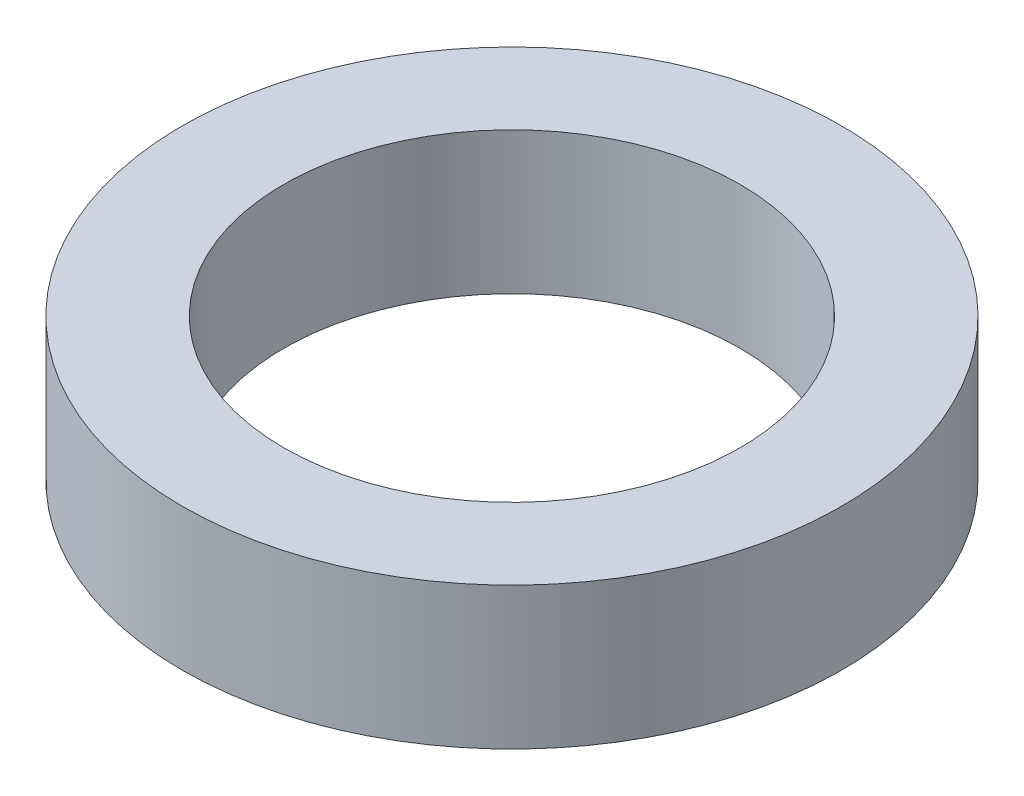
from build123d import *

# Parameters (mm, degrees)
SKETCH1_R           = 65
BOSS_EXTRUDE1_DEPTH = 28
SKETCH2_R           = 45
CUT_EXTRUDE1_DEPTH  = 97.093704268


with BuildPart() as part:
    # Sketch1 → Boss-Extrude1 (new body)
    with BuildSketch(Plane(origin=(0, 0, 0), x_dir=(1, 0, 0), z_dir=(0, 1, 0))):
        Circle(SKETCH1_R)
    extrude(amount=BOSS_EXTRUDE1_DEPTH)

    # Sketch2 → Cut-Extrude1 (cut, through all)
    with BuildSketch(Plane(origin=(0, 0, 0), x_dir=(1, 0, 0), z_dir=(0, 1, 0))):
        Circle(SKETCH2_R)
    extrude(amount=CUT_EXTRUDE1_DEPTH, mode=Mode.SUBTRACT)


solid = part.part
